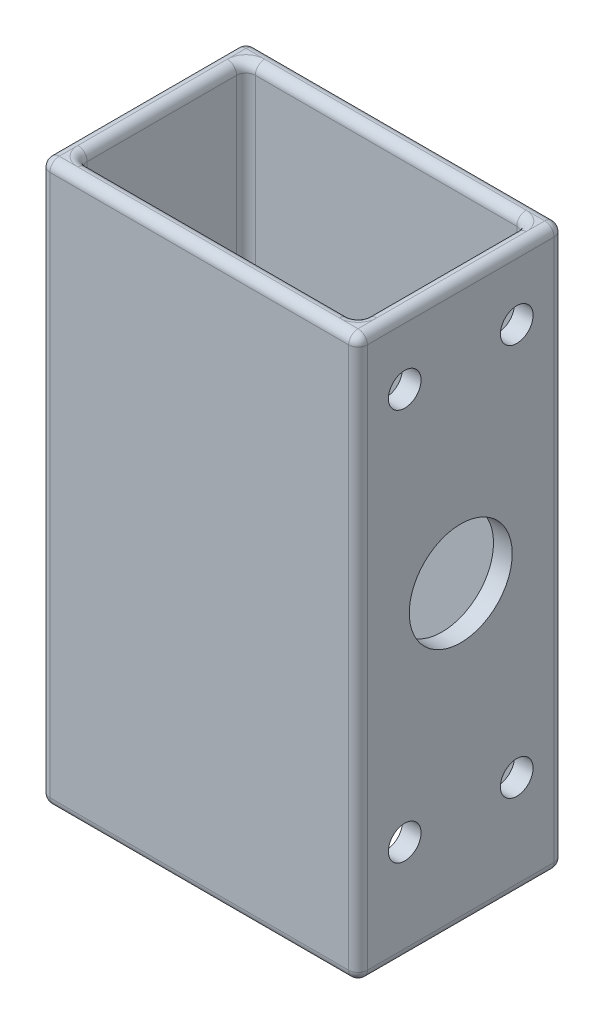
from build123d import *

# Parameters (mm, degrees)
SKETCH1_W           = 43.18
SKETCH1_H           = 27.94
SKETCH1_W_2         = 38.1
SKETCH1_H_2         = 22.86
BOSS_EXTRUDE1_DEPTH = 76.2
CUT_EXTRUDE1_REACH  = 93.193
SKETCH3_R           = 2.2225
SKETCH3_R_2         = 6.99999997
CUT_EXTRUDE2_REACH  = 93.193
SKETCH2_W           = 19.91868
SKETCH2_H           = 38.1
SKETCH2_W_2         = 1.47066
SKETCH2_H_2         = 1.0795
SKETCH2_R           = 2.2225
FILLET1_R           = 1.27
FILLET2_R           = 1.27


# Some blends are built 0.0001 mm under size
with BuildPart() as part:
    # Sketch1 → Boss-Extrude1 (new body)
    with BuildSketch(Plane(origin=(0, 0, 0), x_dir=(1, 0, 0), z_dir=(0, 1, 0))):
        with Locations((19.05, 11.43)):
            Rectangle(SKETCH1_W, SKETCH1_H)
        with Locations((19.05, 11.43)):
            Rectangle(SKETCH1_W_2, SKETCH1_H_2, mode=Mode.SUBTRACT)
    extrude(amount=BOSS_EXTRUDE1_DEPTH)

    # Sketch3 → Cut-Extrude1 (cut, up to next)
    with BuildSketch(Plane(origin=(40.64, 0, 0), x_dir=(0, 0, -1), z_dir=(1, 0, 0)), mode=Mode.PRIVATE) as cut_extrude1_sk1:
        with Locations((19.05, 67.16268)):
            Circle(SKETCH3_R)
    cut_extrude1_tool1 = extrude(cut_extrude1_sk1.sketch, amount=-CUT_EXTRUDE1_REACH, mode=Mode.PRIVATE) & part.part
    # Sketch3 → Cut-Extrude1 (cut, up to next)
    with BuildSketch(Plane(origin=(40.64, 0, 0), x_dir=(0, 0, -1), z_dir=(1, 0, 0)), mode=Mode.PRIVATE) as cut_extrude1_sk2:
        with Locations((3.81, 67.16268)):
            Circle(SKETCH3_R)
    cut_extrude1_tool2 = extrude(cut_extrude1_sk2.sketch, amount=-CUT_EXTRUDE1_REACH, mode=Mode.PRIVATE) & part.part
    # Sketch3 → Cut-Extrude1 (cut, up to next)
    with BuildSketch(Plane(origin=(40.64, 0, 0), x_dir=(0, 0, -1), z_dir=(1, 0, 0)), mode=Mode.PRIVATE) as cut_extrude1_sk3:
        with Locations((19.05, 13.82268)):
            Circle(SKETCH3_R)
    cut_extrude1_tool3 = extrude(cut_extrude1_sk3.sketch, amount=-CUT_EXTRUDE1_REACH, mode=Mode.PRIVATE) & part.part
    # Sketch3 → Cut-Extrude1 (cut, up to next)
    with BuildSketch(Plane(origin=(40.64, 0, 0), x_dir=(0, 0, -1), z_dir=(1, 0, 0)), mode=Mode.PRIVATE) as cut_extrude1_sk4:
        with Locations((3.81, 13.82268)):
            Circle(SKETCH3_R)
    cut_extrude1_tool4 = extrude(cut_extrude1_sk4.sketch, amount=-CUT_EXTRUDE1_REACH, mode=Mode.PRIVATE) & part.part
    # Sketch3 → Cut-Extrude1 (cut, up to next)
    with BuildSketch(Plane(origin=(40.64, 0, 0), x_dir=(0, 0, -1), z_dir=(1, 0, 0)), mode=Mode.PRIVATE) as cut_extrude1_sk5:
        with Locations((11.43, 40.49268)):
            Circle(SKETCH3_R_2)
    cut_extrude1_tool5 = extrude(cut_extrude1_sk5.sketch, amount=-CUT_EXTRUDE1_REACH, mode=Mode.PRIVATE) & part.part
    add(cut_extrude1_tool1.solids().sort_by_distance((40.64, 67.16268, -19.05))[0], mode=Mode.SUBTRACT)
    add(cut_extrude1_tool2.solids().sort_by_distance((40.64, 67.16268, -3.81))[0], mode=Mode.SUBTRACT)
    add(cut_extrude1_tool3.solids().sort_by_distance((40.64, 13.82268, -19.05))[0], mode=Mode.SUBTRACT)
    add(cut_extrude1_tool4.solids().sort_by_distance((40.64, 13.82268, -3.81))[0], mode=Mode.SUBTRACT)
    add(cut_extrude1_tool5.solids().sort_by_distance((40.64, 40.49268, -11.43))[0], mode=Mode.SUBTRACT)

    # Sketch2 → Cut-Extrude2 (cut, up to next)
    with BuildSketch(Plane.ZY.offset(2.54), mode=Mode.PRIVATE) as cut_extrude2_sk1:
        with Locations((-11.43, 30.64383099)):
            Rectangle(SKETCH2_W, SKETCH2_H)
    cut_extrude2_tool1 = extrude(cut_extrude2_sk1.sketch, amount=-CUT_EXTRUDE2_REACH, mode=Mode.PRIVATE) & part.part
    # Sketch2 → Cut-Extrude2 (cut, up to next)
    with BuildSketch(Plane.ZY.offset(2.54), mode=Mode.PRIVATE) as cut_extrude2_sk2:
        with Locations((-22.12467, 30.64383099)):
            Rectangle(SKETCH2_W_2, SKETCH2_H)
    cut_extrude2_tool2 = extrude(cut_extrude2_sk2.sketch, amount=-CUT_EXTRUDE2_REACH, mode=Mode.PRIVATE) & part.part
    # Sketch2 → Cut-Extrude2 (cut, up to next)
    with BuildSketch(Plane.ZY.offset(2.54), mode=Mode.PRIVATE) as cut_extrude2_sk3:
        with Locations((-11.43, 50.23358099)):
            Rectangle(SKETCH2_W, SKETCH2_H_2)
    cut_extrude2_tool3 = extrude(cut_extrude2_sk3.sketch, amount=-CUT_EXTRUDE2_REACH, mode=Mode.PRIVATE) & part.part
    # Sketch2 → Cut-Extrude2 (cut, up to next)
    with BuildSketch(Plane.ZY.offset(2.54), mode=Mode.PRIVATE) as cut_extrude2_sk4:
        with Locations((-0.73533, 30.64383099)):
            Rectangle(SKETCH2_W_2, SKETCH2_H)
    cut_extrude2_tool4 = extrude(cut_extrude2_sk4.sketch, amount=-CUT_EXTRUDE2_REACH, mode=Mode.PRIVATE) & part.part
    # Sketch2 → Cut-Extrude2 (cut, up to next)
    with BuildSketch(Plane.ZY.offset(2.54), mode=Mode.PRIVATE) as cut_extrude2_sk5:
        with Locations((-11.43, 11.05408099)):
            Rectangle(SKETCH2_W, SKETCH2_H_2)
    cut_extrude2_tool5 = extrude(cut_extrude2_sk5.sketch, amount=-CUT_EXTRUDE2_REACH, mode=Mode.PRIVATE) & part.part
    # Sketch2 → Cut-Extrude2 (cut, up to next)
    with BuildSketch(Plane.ZY.offset(2.54), mode=Mode.PRIVATE) as cut_extrude2_sk6:
        with Locations((-6.47954, 6.64337099)):
            Circle(SKETCH2_R)
    cut_extrude2_tool6 = extrude(cut_extrude2_sk6.sketch, amount=-CUT_EXTRUDE2_REACH, mode=Mode.PRIVATE) & part.part
    # Sketch2 → Cut-Extrude2 (cut, up to next)
    with BuildSketch(Plane.ZY.offset(2.54), mode=Mode.PRIVATE) as cut_extrude2_sk7:
        with Locations((-16.38046, 6.64337099)):
            Circle(SKETCH2_R)
    cut_extrude2_tool7 = extrude(cut_extrude2_sk7.sketch, amount=-CUT_EXTRUDE2_REACH, mode=Mode.PRIVATE) & part.part
    # Sketch2 → Cut-Extrude2 (cut, up to next)
    with BuildSketch(Plane.ZY.offset(2.54), mode=Mode.PRIVATE) as cut_extrude2_sk8:
        with Locations((-16.38046, 54.64429099)):
            Circle(SKETCH2_R)
    cut_extrude2_tool8 = extrude(cut_extrude2_sk8.sketch, amount=-CUT_EXTRUDE2_REACH, mode=Mode.PRIVATE) & part.part
    # Sketch2 → Cut-Extrude2 (cut, up to next)
    with BuildSketch(Plane.ZY.offset(2.54), mode=Mode.PRIVATE) as cut_extrude2_sk9:
        with Locations((-6.47954, 54.64429099)):
            Circle(SKETCH2_R)
    cut_extrude2_tool9 = extrude(cut_extrude2_sk9.sketch, amount=-CUT_EXTRUDE2_REACH, mode=Mode.PRIVATE) & part.part
    add(cut_extrude2_tool1.solids().sort_by_distance((-2.54, 30.643831, -11.43))[0], mode=Mode.SUBTRACT)
    add(cut_extrude2_tool2.solids().sort_by_distance((-2.54, 30.643831, -22.12467))[0], mode=Mode.SUBTRACT)
    add(cut_extrude2_tool3.solids().sort_by_distance((-2.54, 50.233581, -11.43))[0], mode=Mode.SUBTRACT)
    add(cut_extrude2_tool4.solids().sort_by_distance((-2.54, 30.643831, -0.73533))[0], mode=Mode.SUBTRACT)
    add(cut_extrude2_tool5.solids().sort_by_distance((-2.54, 11.054081, -11.43))[0], mode=Mode.SUBTRACT)
    add(cut_extrude2_tool6.solids().sort_by_distance((-2.54, 6.643371, -6.47954))[0], mode=Mode.SUBTRACT)
    add(cut_extrude2_tool7.solids().sort_by_distance((-2.54, 6.643371, -16.38046))[0], mode=Mode.SUBTRACT)
    add(cut_extrude2_tool8.solids().sort_by_distance((-2.54, 54.644291, -16.38046))[0], mode=Mode.SUBTRACT)
    add(cut_extrude2_tool9.solids().sort_by_distance((-2.54, 54.644291, -6.47954))[0], mode=Mode.SUBTRACT)

    # Fillet1
    # the kernel refuses this fillet: 1.27 mm, written as the material it adds along each edge
    with BuildSketch(Plane(origin=(-2.54, 10.51433099, -1.47066), x_dir=(0, 0, -1), z_dir=(1, 0, 0)), Plane(origin=(-2.54, 50.77333099, -21.38934), x_dir=(0, 0, 1), z_dir=(1, 0, 0))) as fillet1_piece_1:
        with BuildLine():
            CenterArc((1.255631216, 1.27), FILLET1_R, 188.626926559, 81.373073441)
            Line((0, 1.0795), (-0.025112624, 1.07569))
            ThreePointArc((-0.025112624, 1.07569), (-0.0254, 0.53975), (-0.0254, 0))
            Line((-0.0254, 0), (0, -0.0254))
            Line((0, -0.0254), (1.255631216, -0.0254))
            Line((1.255631216, -0.0254), (1.255631216, 0))
        make_face()
    extrude(amount=2.54)
    with BuildSketch(Plane(origin=(-2.54, 10.51433099, -21.38934), x_dir=(0, 1, 0), z_dir=(1, 0, 0)), Plane(origin=(-2.54, 50.77333099, -1.47066), x_dir=(0, -1, 0), z_dir=(1, 0, 0))) as fillet1_piece_2:
        with BuildLine():
            CenterArc((1.27, 1.255631216), FILLET1_R, 180, 81.373073441)
            Line((0, 1.255631216), (-0.0254, 1.255631216))
            Line((-0.0254, 1.255631216), (-0.0254, 0))
            Line((-0.0254, 0), (0, -0.0254))
            ThreePointArc((0, -0.0254), (0.53975, -0.0254), (1.07569, -0.025112624))
            Line((1.07569, -0.025112624), (1.0795, 0))
        make_face()
    extrude(amount=2.54)

    # Fillet2
    fillet2_edges = [part.edges().sort_by_distance(p)[0] for p in [
        (40.64, 76.2, -11.43),
        (0, 0, -11.43),
        (0, 62.946915495, -22.86),
        (19.05, 0, 0),
        (0, 62.946915495, 0),
        (38.1, 0, -11.43),
        (38.1, 38.1, 0),
        (19.05, 0, -22.86),
        (38.1, 38.1, -22.86),
        (0, 76.2, -11.43),
        (19.05, 76.2, -25.4),
        (19.05, 76.2, 0),
        (38.1, 76.2, -11.43),
        (19.05, 76.2, -22.86),
        (-2.54, 76.2, -11.43),
        (19.05, 0, -25.4),
        (0, 5.796915495, -22.86),
        (0, 5.796915495, 0),
        (40.64, 0, -11.43),
        (19.05, 0, 2.54),
        (-2.54, 0, -11.43),
        (-2.54, 38.1, -25.4),
        (40.64, 38.1, -25.4),
        (40.64, 38.1, 2.54),
        (-2.54, 38.1, 2.54),
        (19.05, 76.2, 2.54),
    ]]
    fillet(fillet2_edges, radius=FILLET2_R - 0.0001)  # a hair under: the kernel refuses the full size


solid = part.part
